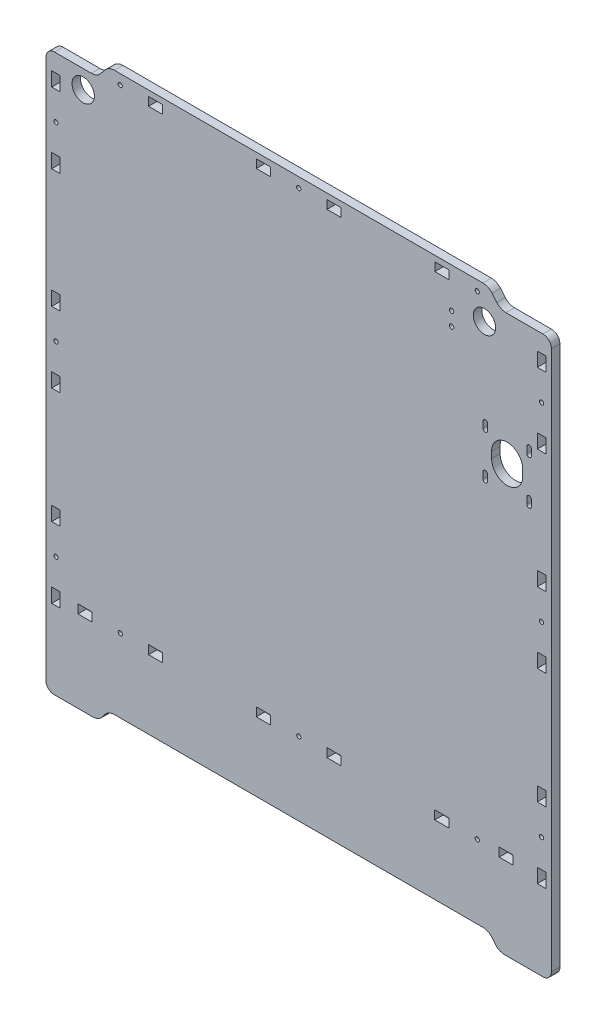
from build123d import *

# Parameters (mm, degrees)
SKETCH_1_R      = 1.55
SKETCH_1_R_2    = 7.9
SKETCH_1_R_3    = 1.500000002
SKETCH_1_R_4    = 1.500000001
SKETCH_1_R_5    = 1.5
SKETCH_1_W      = 6
SKETCH_1_H      = 10
SKETCH_1_W_2    = 9.994814166
SKETCH_1_H_2    = 6.199822499
SKETCH_1_W_3    = 9.849167249
SKETCH_1_W_4    = 10
SKETCH_1_H_3    = 6
SKETCH_1_W_5    = 9.849167498
SKETCH_1_W_6    = 9.949996322
SKETCH_1_W_7    = 9.96963529
SKETCH_1_H_4    = 6.199787221
SKETCH_1_W_8    = 9.974357274
EXTRUDE_1_DEPTH = 6


with BuildPart() as part:
    # Эскиз1 → Бобышка-Вытянуть1 (new body)
    with BuildSketch(Plane.XY):
        with BuildLine():
            Line((146.728432874, 193.302051095), (172.76481778, 193.302051095))
            ThreePointArc((172.76481778, 193.302051095), (177.038597027, 191.56796477), (178.819099243, 187.313313634))
            Line((178.819099243, 187.313313634), (178.819099243, -193.997737318))
            ThreePointArc((178.819099243, -193.997737318), (177.04259214, -198.259685315), (172.764817781, -199.997737318))
            Line((172.764817781, -199.997737318), (145.728432875, -199.997737318))
            ThreePointArc((145.728432875, -199.997737318), (142.13617765, -199.201353507), (139.217055109, -196.961432))
            Line((139.217055109, -196.961432), (136.921229056, -193.941778905))
            ThreePointArc((136.921229056, -193.941778905), (134.002106514, -191.701857397), (130.409851289, -190.905473587))
            Line((130.409851289, -190.905473587), (-129.880215727, -190.905473587))
            ThreePointArc((-129.880215727, -190.905473587), (-133.472470952, -191.701857397), (-136.391593494, -193.941778905))
            Line((-136.391593494, -193.941778905), (-138.687419547, -196.961432))
            ThreePointArc((-138.687419547, -196.961432), (-141.606542089, -199.201353507), (-145.198797313, -199.997737318))
            Line((-145.198797313, -199.997737318), (-172.235182219, -199.997737318))
            ThreePointArc((-172.235182219, -199.997737318), (-175.957867453, -198.836968562), (-178.180900757, -195.633237551))
            Line((-178.180900757, -195.633237551), (-178.180900757, 187.302262682))
            ThreePointArc((-178.180900757, 187.302262682), (-176.423541444, 191.54490337), (-172.180900757, 193.302262682))
            Line((-172.180900757, 193.302262682), (-146.198797314, 193.302262682))
            ThreePointArc((-146.198797314, 193.302262682), (-142.60654209, 194.098646493), (-139.687419548, 196.338568))
            Line((-139.687419548, 196.338568), (-136.391593495, 200.265957365))
            ThreePointArc((-136.391593495, 200.265957365), (-133.472470953, 202.505878872), (-129.880215728, 203.302262682))
            Line((-129.880215728, 203.302262682), (130.409851288, 203.302262682))
            ThreePointArc((130.409851288, 203.302262682), (134.002106513, 202.505878872), (136.921229055, 200.265957365))
            Line((136.921229055, 200.265957365), (140.217104458, 196.338462243))
            ThreePointArc((140.217104458, 196.338462243), (143.136190594, 194.098493291), (146.728432874, 193.302051095))
        make_face()
        with Locations((108.319099243, 165.602262682)):
            Circle(SKETCH_1_R, mode=Mode.SUBTRACT)
        with Locations((108.319099243, 175.302262682)):
            Circle(SKETCH_1_R, mode=Mode.SUBTRACT)
        with Locations((131.519099243, 180.302262682)):
            Circle(SKETCH_1_R_2, mode=Mode.SUBTRACT)
        with Locations((-151.980900757, 180.302262682)):
            Circle(SKETCH_1_R_2, mode=Mode.SUBTRACT)
        with Locations((-171.180900757, 150.902262682)):
            Circle(SKETCH_1_R_3, mode=Mode.SUBTRACT)
        with Locations((-171.180900757, 16.742262682)):
            Circle(SKETCH_1_R_4, mode=Mode.SUBTRACT)
        with Locations((171.819099243, 150.902051095)):
            Circle(SKETCH_1_R_4, mode=Mode.SUBTRACT)
        with Locations((126.459099243, 196.302262682)):
            Circle(SKETCH_1_R_5, mode=Mode.SUBTRACT)
        with Locations((-125.820900757, 196.302262682)):
            Circle(SKETCH_1_R_5, mode=Mode.SUBTRACT)
        with Locations((0.319099243, 196.302262682)):
            Circle(SKETCH_1_R_5, mode=Mode.SUBTRACT)
        with Locations((-125.74954067, -139.065910363)):
            Circle(SKETCH_1_R_5, mode=Mode.SUBTRACT)
        with Locations((-171.180900757, -114.967737318)):
            Circle(SKETCH_1_R_5, mode=Mode.SUBTRACT)
        with Locations((0.375695716, -139.065910363)):
            Circle(SKETCH_1_R_5, mode=Mode.SUBTRACT)
        with Locations((126.442808867, -139.065910363)):
            Circle(SKETCH_1_R_5, mode=Mode.SUBTRACT)
        with Locations((171.819099243, -114.967948905)):
            Circle(SKETCH_1_R_5, mode=Mode.SUBTRACT)
        with Locations((171.819099244, 16.742051095)):
            Circle(SKETCH_1_R_5, mode=Mode.SUBTRACT)
        with BuildLine():
            Line((133.65547985, 83.46981119), (133.65547985, 87.96981119))
            ThreePointArc((133.65547985, 87.96981119), (132.05547985, 89.56981119), (130.45547985, 87.96981119))
            Line((130.45547985, 87.96981119), (130.45547985, 83.46981119))
            ThreePointArc((130.45547985, 83.46981119), (132.05547985, 81.86981119), (133.65547985, 83.46981119))
        make_face(mode=Mode.SUBTRACT)
        with BuildLine():
            Line((133.65547985, 118.96981119), (133.65547985, 114.46981119))
            ThreePointArc((133.65547985, 114.46981119), (132.05547985, 112.86981119), (130.45547985, 114.46981119))
            Line((130.45547985, 114.46981119), (130.45547985, 118.96981119))
            ThreePointArc((130.45547985, 118.96981119), (132.05547985, 120.56981119), (133.65547985, 118.96981119))
        make_face(mode=Mode.SUBTRACT)
        with BuildLine():
            Line((158.55547985, 98.96981119), (158.55547985, 103.46981119))
            ThreePointArc((158.55547985, 103.46981119), (147.55547985, 114.46981119), (136.55547985, 103.46981119))
            Line((136.55547985, 103.46981119), (136.55547985, 98.96981119))
            ThreePointArc((136.55547985, 98.96981119), (147.55547985, 87.96981119), (158.55547985, 98.96981119))
        make_face(mode=Mode.SUBTRACT)
        with BuildLine():
            Line((161.45547985, 118.96981119), (161.45547985, 114.46981119))
            ThreePointArc((161.45547985, 114.46981119), (163.05547985, 112.86981119), (164.65547985, 114.46981119))
            Line((164.65547985, 114.46981119), (164.65547985, 118.96981119))
            ThreePointArc((164.65547985, 118.96981119), (163.05547985, 120.56981119), (161.45547985, 118.96981119))
        make_face(mode=Mode.SUBTRACT)
        with BuildLine():
            Line((161.45547985, 83.46981119), (161.45547985, 87.96981119))
            ThreePointArc((161.45547985, 87.96981119), (163.05547985, 89.56981119), (164.65547985, 87.96981119))
            Line((164.65547985, 87.96981119), (164.65547985, 83.46981119))
            ThreePointArc((164.65547985, 83.46981119), (163.05547985, 81.86981119), (161.45547985, 83.46981119))
        make_face(mode=Mode.SUBTRACT)
        with Locations((-171.180900756, 41.742262682)):
            Rectangle(SKETCH_1_W, SKETCH_1_H, mode=Mode.SUBTRACT)
        with Locations((101.375242683, -139.100475893)):
            Rectangle(SKETCH_1_W_2, SKETCH_1_H_2, mode=Mode.SUBTRACT)
        with Locations((146.834619429, -139.100475893)):
            Rectangle(SKETCH_1_W_3, SKETCH_1_H_2, mode=Mode.SUBTRACT)
        with Locations((-24.670900757, 196.302262682)):
            Rectangle(SKETCH_1_W_4, SKETCH_1_H_3, mode=Mode.SUBTRACT)
        with Locations((25.309099243, 196.302262682)):
            Rectangle(SKETCH_1_W_4, SKETCH_1_H_3, mode=Mode.SUBTRACT)
        with Locations((-150.741012535, -139.100475893)):
            Rectangle(SKETCH_1_W_5, SKETCH_1_H_2, mode=Mode.SUBTRACT)
        with Locations((-100.791387959, -139.100475893)):
            Rectangle(SKETCH_1_W_6, SKETCH_1_H_2, mode=Mode.SUBTRACT)
        with Locations((-24.706795773, -139.09908242)):
            Rectangle(SKETCH_1_W_7, SKETCH_1_H_4, mode=Mode.SUBTRACT)
        with Locations((25.290883071, -139.09908242)):
            Rectangle(SKETCH_1_W_8, SKETCH_1_H_4, mode=Mode.SUBTRACT)
        with Locations((-171.180900757, -8.257737318)):
            Rectangle(SKETCH_1_W, SKETCH_1_H, mode=Mode.SUBTRACT)
        with Locations((-171.180900757, 175.902262682)):
            Rectangle(SKETCH_1_W, SKETCH_1_H, mode=Mode.SUBTRACT)
        with Locations((-171.180900757, 125.902262682)):
            Rectangle(SKETCH_1_W, SKETCH_1_H, mode=Mode.SUBTRACT)
        with Locations((-171.180900756, -89.987737318)):
            Rectangle(SKETCH_1_W, SKETCH_1_H, mode=Mode.SUBTRACT)
        with Locations((-171.180900757, -139.977737318)):
            Rectangle(SKETCH_1_W, SKETCH_1_H, mode=Mode.SUBTRACT)
        with Locations((171.819099243, 41.742051095)):
            Rectangle(SKETCH_1_W, SKETCH_1_H, mode=Mode.SUBTRACT)
        with Locations((171.819099243, -8.257948905)):
            Rectangle(SKETCH_1_W, SKETCH_1_H, mode=Mode.SUBTRACT)
        with Locations((171.819099244, -89.987948905)):
            Rectangle(SKETCH_1_W, SKETCH_1_H, mode=Mode.SUBTRACT)
        with Locations((171.819099243, -139.977948905)):
            Rectangle(SKETCH_1_W, SKETCH_1_H, mode=Mode.SUBTRACT)
        Polygon((168.819099243, 170.902051095), (168.819099243, 180.902051095), (174.819099243, 180.902051095), (174.819099243, 170.978103712), (175.145177162, 170.902051095), align=None, mode=Mode.SUBTRACT)
        with Locations((171.819099243, 125.902051095)):
            Rectangle(SKETCH_1_W, SKETCH_1_H, mode=Mode.SUBTRACT)
        with Locations((-100.820900757, 196.302262682)):
            Rectangle(SKETCH_1_W_4, SKETCH_1_H_3, mode=Mode.SUBTRACT)
        with Locations((101.459099243, 196.302262682)):
            Rectangle(SKETCH_1_W_4, SKETCH_1_H_3, mode=Mode.SUBTRACT)
    extrude(amount=EXTRUDE_1_DEPTH)


solid = part.part
